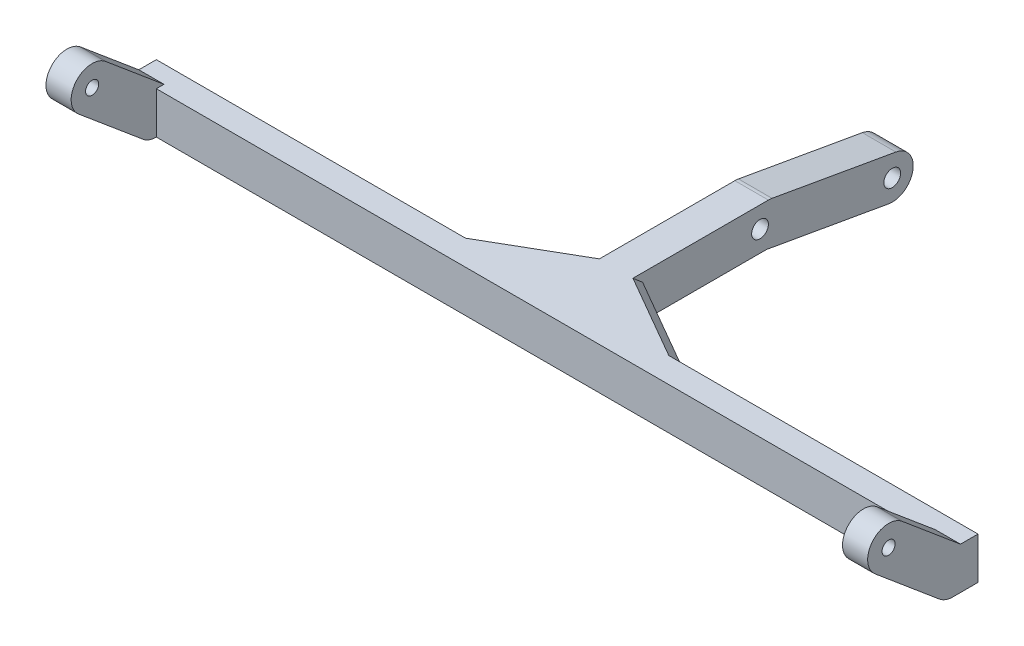
from build123d import *

# Parameters (mm, degrees)
EXTRUDE_1_DEPTH          = 5
FILLET_1_R               = 5
EXTRUDE_START            = 98
SKETCH_9_R               = 1.563633766
EXTRUDE_4_DEPTH          = 6
EXTRUDE_START_2          = -92
SKETCH_9_2_R             = 1.563633766
EXTRUDE_5_DEPTH          = 6
SKETCH_10_R              = 2
EXTRUDE_6_DEPTH          = 4
CUT_EXTRUDE_1_DEPTH      = 131.654334604
CUT_EXTRUDE_1_DEPTH_BACK = 131.654334604
SKETCH_11_R              = 2
CHAMFER_1_SIZE           = 2


with BuildPart() as part:
    # 草图1 → 凸台-拉伸1 (new, symmetric)
    with BuildSketch(Plane(origin=(0, 0, 0), x_dir=(1, 0, 0), z_dir=(0, 1, 0))):
        Polygon((98, 0), (-98, 0), (-98, 8), (-24.784609691, 8), (-4, 20), (-4, 55), (4, 55), (4, 20), (24.784609691, 8), (98, 8), align=None)
    extrude(amount=EXTRUDE_1_DEPTH, both=True)

    # 圆角1
    fillet_1_edges = [part.edges().sort_by_distance(p)[0] for p in [
        (0, -5, -55),
        (0, 5, -55),
    ]]
    fillet(fillet_1_edges, radius=FILLET_1_R - 0.0001)  # a hair under: the kernel refuses the full size

    # 草图9 → 凸台-拉伸4 (add)
    with BuildSketch(Plane(origin=(0, 0, 0), x_dir=(0, 0, -1), z_dir=(1, 0, 0)).offset(EXTRUDE_START)):
        with BuildLine():
            Line((3.213938048, 3.830222216), (-12.106950814, 16.685974409))
            ThreePointArc((-12.106950814, 16.685974409), (-19.151111078, 16.069690242), (-18.534826911, 9.025529978))
            Line((-18.534826911, 9.025529978), (-3.213938048, -3.830222216))
            ThreePointArc((-3.213938048, -3.830222216), (3.830222216, -3.213938048), (3.213938048, 3.830222216))
        make_face()
        with Locations(Location((-15.320888862, 12.855752194, 0), (0, 0, 180))):
            Circle(SKETCH_9_R, mode=Mode.SUBTRACT)
    extrude(amount=-EXTRUDE_4_DEPTH)

    # 草图9<2> → 凸台-拉伸5 (add)
    with BuildSketch(Plane(origin=(0, 0, 0), x_dir=(0, 0, -1), z_dir=(1, 0, 0)).offset(EXTRUDE_START_2)):
        with BuildLine():
            Line((3.213938048, 3.830222216), (-12.106950814, 16.685974409))
            ThreePointArc((-12.106950814, 16.685974409), (-19.151111078, 16.069690242), (-18.534826911, 9.025529978))
            Line((-18.534826911, 9.025529978), (-3.213938048, -3.830222216))
            ThreePointArc((-3.213938048, -3.830222216), (3.830222216, -3.213938048), (3.213938048, 3.830222216))
        make_face()
        with Locations(Location((-15.320888862, 12.855752194, 0), (0, 0, 180))):
            Circle(SKETCH_9_2_R, mode=Mode.SUBTRACT)
    extrude(amount=-EXTRUDE_5_DEPTH)

    # 草图10 → 凸台-拉伸6 (add, symmetric)
    with BuildSketch(Plane(origin=(0, 0, 0), x_dir=(0, 0, -1), z_dir=(1, 0, 0))):
        with BuildLine():
            Line((50.868240888, 4.924038765), (80.412473479, -0.285406565))
            ThreePointArc((80.412473479, -0.285406565), (84.468271355, -6.077686218), (78.675991702, -10.133484095))
            Line((78.675991702, -10.133484095), (49.131759112, -4.924038765))
            ThreePointArc((49.131759112, -4.924038765), (45.075961235, 0.868240888), (50.868240888, 4.924038765))
        make_face()
        with Locations((79.54423259, -5.20944533)):
            Circle(SKETCH_10_R, mode=Mode.SUBTRACT)
    extrude(amount=EXTRUDE_6_DEPTH, both=True)

    # 草图11 → 切除-拉伸1 (cut, two sides: drawn at the far end of the back side and taken through both)
    with BuildSketch(Plane(origin=(0, 0, 0), x_dir=(0, 0, -1), z_dir=(1, 0, 0)).offset(-CUT_EXTRUDE_1_DEPTH_BACK)):
        with Locations((48, 0)):
            Circle(SKETCH_11_R)
    extrude(amount=CUT_EXTRUDE_1_DEPTH + CUT_EXTRUDE_1_DEPTH_BACK, mode=Mode.SUBTRACT)

    # 倒角1
    chamfer_1_edges = [part.edges().sort_by_distance(p)[0] for p in [
        (-61.392304845, -5, -8),
        (-14.392304845, -5, -14),
        (14.392304845, -5, -14),
        (61.392304845, -5, -8),
        (61.392304845, 5, -8),
        (-98, 0, -8),
        (98, 0, -8),
        (14.392304845, 5, -14),
        (-14.392304845, 5, -14),
        (-61.392304845, 5, -8),
    ]]
    chamfer(chamfer_1_edges, length=CHAMFER_1_SIZE)


solid = part.part
